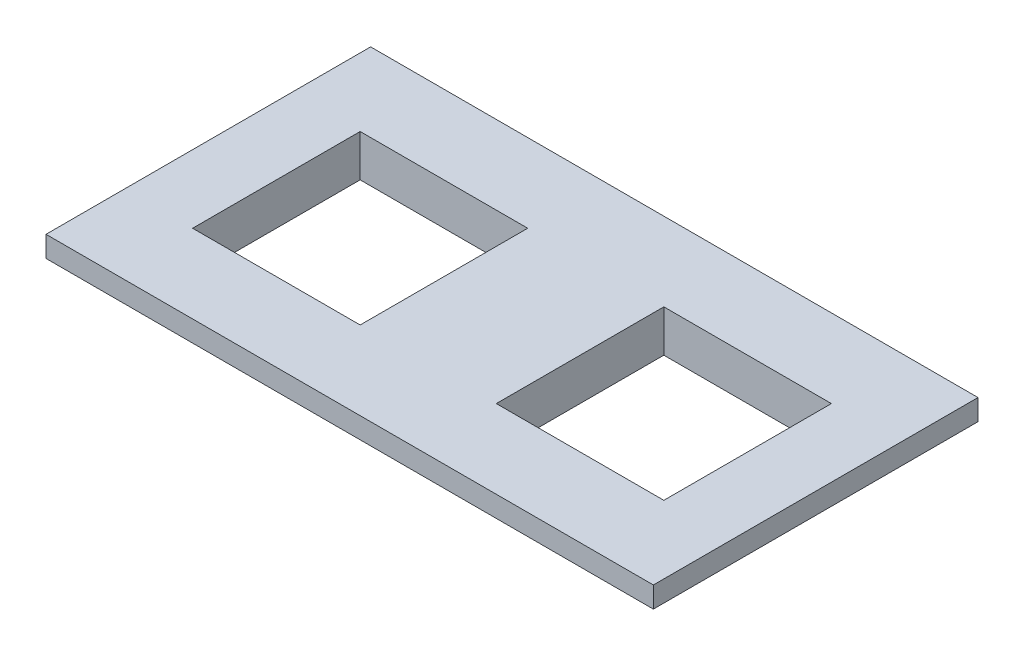
from build123d import *

# Parameters (mm, degrees)
SKETCH1_W                = 29
SKETCH1_H                = 15.5
BOSS_EXTRUDE1_DEPTH      = 8
SHELL1_T                 = -1
SKETCH2_W                = 1
SKETCH2_H                = 13.5
BOSS_EXTRUDE2_DEPTH      = 7
SKETCH3_W                = 8
SKETCH3_H                = 3
CUT_EXTRUDE1_DEPTH       = 7
SKETCH4_W                = 29
SKETCH4_H                = 2
BOSS_EXTRUDE3_DEPTH      = 15.5
INTERSECT1_OUTLINE_W     = 29
INTERSECT1_OUTLINE_H     = 15.5
INTERSECT1_OUTLINE_W_2   = 8
INTERSECT1_OUTLINE_H_2   = 3
INTERSECT1_DEPTH         = 7
INTERSECT1_START         = 7
INTERSECT1_2_OUTLINE_W   = 29
INTERSECT1_2_OUTLINE_H   = 15.5
INTERSECT1_2_OUTLINE_W_2 = 13
INTERSECT1_2_OUTLINE_H_2 = 13.5
INTERSECT1_2_DEPTH       = 1
SKETCH5_W                = 8
SKETCH5_H                = 8
CUT_EXTRUDE2_DEPTH       = 15.5


# Read off the part's stored shape, not the designer's step: Intersect1
with BuildPart() as part:
    # Sketch1 → Boss-Extrude1 (new body)
    with BuildSketch(Plane(origin=(0, 0, 0), x_dir=(1, 0, 0), z_dir=(0, 1, 0))):
        Rectangle(SKETCH1_W, SKETCH1_H)
    extrude(amount=BOSS_EXTRUDE1_DEPTH)

    # Shell1
    shell1_openings = [part.faces().sort_by_distance(p)[0] for p in [
        (0, 8, 0),
    ]]
    offset(amount=SHELL1_T, openings=shell1_openings, kind=Kind.INTERSECTION)

    # Sketch2 → Boss-Extrude2 (add)
    with BuildSketch(Plane(origin=(0, 1, 0), x_dir=(1, 0, 0), z_dir=(0, 1, 0))):
        Rectangle(SKETCH2_W, SKETCH2_H)
    extrude(amount=BOSS_EXTRUDE2_DEPTH)

    # Sketch3 → Cut-Extrude1 (cut)
    with BuildSketch(Plane(origin=(0, 1, 0), x_dir=(1, 0, 0), z_dir=(0, 1, 0))):
        with Locations((-7.25, 5.25)):
            Rectangle(SKETCH3_W, SKETCH3_H)
        with Locations((7.25, 5.25)):
            Rectangle(SKETCH3_W, SKETCH3_H)
        with Locations((7.25, -5.25)):
            Rectangle(SKETCH3_W, SKETCH3_H)
        with Locations((-7.25, -5.25)):
            Rectangle(SKETCH3_W, SKETCH3_H)
    extrude(amount=-CUT_EXTRUDE1_DEPTH, mode=Mode.SUBTRACT)

    # Intersect1 outline → Intersect1 (cut)
    with BuildSketch(Plane(origin=(0, 0, 0), x_dir=(1, 0, 0), z_dir=(0, 1, 0))):
        Rectangle(INTERSECT1_OUTLINE_W, INTERSECT1_OUTLINE_H)
        with Locations((-7.25, -5.25)):
            Rectangle(INTERSECT1_OUTLINE_W_2, INTERSECT1_OUTLINE_H_2, mode=Mode.SUBTRACT)
        with Locations((-7.25, 5.25)):
            Rectangle(INTERSECT1_OUTLINE_W_2, INTERSECT1_OUTLINE_H_2, mode=Mode.SUBTRACT)
        with Locations((7.25, 5.25)):
            Rectangle(INTERSECT1_OUTLINE_W_2, INTERSECT1_OUTLINE_H_2, mode=Mode.SUBTRACT)
        with Locations((7.25, -5.25)):
            Rectangle(INTERSECT1_OUTLINE_W_2, INTERSECT1_OUTLINE_H_2, mode=Mode.SUBTRACT)
    extrude(amount=INTERSECT1_DEPTH, mode=Mode.SUBTRACT)


with BuildPart() as body_2:
    # Sketch4 → Boss-Extrude3 (new body)
    with BuildSketch(Plane.XY.offset(7.75)):
        with Locations((0, 8)):
            Rectangle(SKETCH4_W, SKETCH4_H)
    extrude(amount=-BOSS_EXTRUDE3_DEPTH)


with BuildPart() as intersect1_2_tool:
    # Intersect1 2 outline → Intersect1 2 (new body)
    with BuildSketch(Plane(origin=(0, 0, 0), x_dir=(1, 0, 0), z_dir=(0, 1, 0)).offset(INTERSECT1_START)):
        Rectangle(INTERSECT1_2_OUTLINE_W, INTERSECT1_2_OUTLINE_H)
        with Locations((-7, 0)):
            Rectangle(INTERSECT1_2_OUTLINE_W_2, INTERSECT1_2_OUTLINE_H_2, mode=Mode.SUBTRACT)
        with Locations((7, 0)):
            Rectangle(INTERSECT1_2_OUTLINE_W_2, INTERSECT1_2_OUTLINE_H_2, mode=Mode.SUBTRACT)
    extrude(amount=INTERSECT1_2_DEPTH)


with BuildPart() as part_1:
    add(part.part)

    # Intersect1 2: cut by intersect1_2_tool
    add(intersect1_2_tool.part, mode=Mode.SUBTRACT)


with BuildPart() as body_2_1:
    add(body_2.part)

    # Intersect1 2: cut by intersect1_2_tool
    add(intersect1_2_tool.part, mode=Mode.SUBTRACT)

    # Sketch5 → Cut-Extrude2 (cut)
    with BuildSketch(Plane(origin=(0, 9, 0), x_dir=(1, 0, 0), z_dir=(0, 1, 0))):
        with Locations((-7.25, 0)):
            Rectangle(SKETCH5_W, SKETCH5_H)
        with Locations((7.25, 0)):
            Rectangle(SKETCH5_W, SKETCH5_H)
    extrude(amount=-CUT_EXTRUDE2_DEPTH, mode=Mode.SUBTRACT)


solid = body_2_1.part
